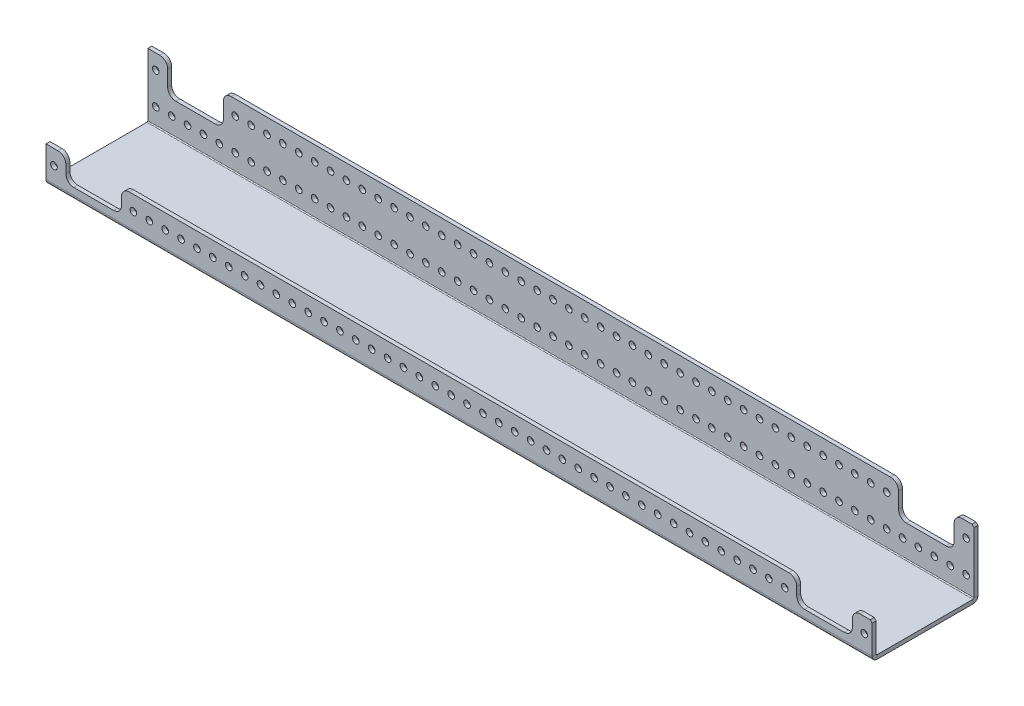
from build123d import *

# Parameters (mm, degrees)
SKETCH1_W             = 787.4
SKETCH1_H             = 78.232
BOSS_EXTRUDE1_DEPTH   = 3.175
EDGE_FLANGE1_DEPTH    = 787.4
EDGE_FLANGE1_2_DEPTH  = 787.4
EDGE_FLANGE2_DEPTH    = 787.4
EDGE_FLANGE2_2_DEPTH  = 787.4
SKETCH9_R             = 2.667
CUT_EXTRUDE1_DEPTH    = 794.767078776
CHAMFER1_SIZE         = 1.5875
LPATTERN1_COUNT       = 62
LPATTERN1_PITCH       = 12.7
SKETCH10_W            = 127
SKETCH10_H            = 125.202186064
CUT_EXTRUDE2_DEPTH    = 794.767078776
SKETCH14_R            = 2.667
CUT_EXTRUDE6_DEPTH    = 5.08
LPATTERN4_COUNT       = 62
LPATTERN4_PITCH       = 12.7
CUT_EXTRUDE7_REACH    = 795.767
SKETCH15_W            = 44.45
SKETCH15_H            = 25.4
LPATTERN5_COUNT       = 2
LPATTERN5_PITCH       = 584.2
LPATTERN6_START       = 142.875
LPATTERN6_OUTLINE_W   = 19.05
LPATTERN6_OUTLINE_H   = 3.175
LPATTERN6_DEPTH       = 44.45
LPATTERN6_START_2     = 727.075
LPATTERN6_2_OUTLINE_W = 19.05
LPATTERN6_2_OUTLINE_H = 3.175
LPATTERN6_2_DEPTH     = 44.45
FILLET1_R             = 6.35


# Read off the part's stored shape, not the designer's step: Edge-Flange1, Edge-Flange2, LPattern6
with BuildPart() as part:
    # Sketch1 → Boss-Extrude1 (new body)
    with BuildSketch(Plane(origin=(0, 0, 0), x_dir=(1, 0, 0), z_dir=(0, 1, 0))):
        with Locations((393.7, 39.116)):
            Rectangle(SKETCH1_W, SKETCH1_H)
    extrude(amount=BOSS_EXTRUDE1_DEPTH)

    # Edge-Flange1 outline → Edge-Flange1 (cut)
    with BuildSketch(Plane.YZ):
        with BuildLine():
            Line((0, -78.232), (0.074445793, -78.232))
            ThreePointArc((0.074445793, -78.232), (0.018655648, -77.852813981), (0, -77.47))
            Line((0, -77.47), (0, -78.232))
        make_face()
    extrude(amount=EDGE_FLANGE1_DEPTH, mode=Mode.SUBTRACT)

    # Edge-Flange1 2 outline → Edge-Flange1 2 (add)
    with BuildSketch(Plane.YZ):
        with BuildLine():
            ThreePointArc((0.074445793, -78.232), (1.4370025, -80.511378224), (3.937, -81.407))
            Line((3.937, -81.407), (53.975, -81.407))
            Line((53.975, -81.407), (53.975, -78.232))
            Line((53.975, -78.232), (3.937, -78.232))
            ThreePointArc((3.937, -78.232), (3.398184633, -78.008815367), (3.175, -77.47))
            Line((3.175, -77.47), (3.175, -78.232))
            Line((3.175, -78.232), (0.074445793, -78.232))
        make_face()
    extrude(amount=EDGE_FLANGE1_2_DEPTH)

    # Edge-Flange2 outline → Edge-Flange2 (cut)
    with BuildSketch(Plane.YZ):
        with BuildLine():
            ThreePointArc((0, -0.762), (0.018655648, -0.379186019), (0.074445793, 0))
            Line((0.074445793, 0), (0, 0))
            Line((0, 0), (0, -0.762))
        make_face()
    extrude(amount=EDGE_FLANGE2_DEPTH, mode=Mode.SUBTRACT)

    # Edge-Flange2 2 outline → Edge-Flange2 2 (add)
    with BuildSketch(Plane.YZ):
        with BuildLine():
            Line((28.575, 3.175), (3.937, 3.175))
            ThreePointArc((3.937, 3.175), (1.4370025, 2.279378224), (0.074445793, 0))
            Line((0.074445793, 0), (3.175, 0))
            Line((3.175, 0), (3.175, -0.762))
            ThreePointArc((3.175, -0.762), (3.398184633, -0.223184633), (3.937, 0))
            Line((3.937, 0), (28.575, 0))
            Line((28.575, 0), (28.575, 3.175))
        make_face()
    extrude(amount=EDGE_FLANGE2_2_DEPTH)

    # Sketch9 → Cut-Extrude1 (cut, through all)
    with BuildSketch(Plane.XY.offset(3.175)):
        with Locations((781.05, 16.637)):
            Circle(SKETCH9_R)
    cut_extrude1 = extrude(amount=-CUT_EXTRUDE1_DEPTH, mode=Mode.SUBTRACT)

    # Chamfer1
    chamfer1_edges = [part.edges().sort_by_distance(p)[0] for p in [
        (787.4, 53.975, -79.8195),
        (0, 53.975, -79.8195),
        (0, 28.575, 1.5875),
        (787.4, 28.575, 1.5875),
    ]]
    chamfer(chamfer1_edges, length=CHAMFER1_SIZE)

    # LPattern1: Cut-Extrude1 ×62
    with Locations(*[(-i * LPATTERN1_PITCH, 0, 0) for i in range(1, LPATTERN1_COUNT)]):
        add(cut_extrude1, mode=Mode.SUBTRACT)

    # Sketch10 → Cut-Extrude2 (cut, through all)
    with BuildSketch(Plane.XY.offset(3.175)):
        with Locations((63.5, 62.601093032)):
            Rectangle(SKETCH10_W, SKETCH10_H)
    extrude(amount=-CUT_EXTRUDE2_DEPTH, mode=Mode.SUBTRACT)

    # Sketch14 → Cut-Extrude6 (cut)
    with BuildSketch(Plane(origin=(0, 0, -81.407), x_dir=(-1, 0, 0), z_dir=(0, 0, -1))):
        with Locations(Location((-781.05, 42.037, 0), (0, 0, 90))):
            Circle(SKETCH14_R)
    cut_extrude6 = extrude(amount=-CUT_EXTRUDE6_DEPTH, mode=Mode.SUBTRACT)

    # LPattern4: Cut-Extrude6 ×62
    with Locations(*[(-i * LPATTERN4_PITCH, 0, 0) for i in range(1, LPATTERN4_COUNT)]):
        add(cut_extrude6, mode=Mode.SUBTRACT)

    # Sketch15 → Cut-Extrude7 (cut, up to next)
    with BuildSketch(Plane(origin=(0, 0, -81.407), x_dir=(-1, 0, 0), z_dir=(0, 0, -1)), mode=Mode.PRIVATE) as cut_extrude7_sk1:
        with Locations((-749.3, 41.275)):
            Rectangle(SKETCH15_W, SKETCH15_H)
    cut_extrude7_tool1 = extrude(cut_extrude7_sk1.sketch, amount=-CUT_EXTRUDE7_REACH, mode=Mode.PRIVATE) & part.part
    cut_extrude7 = cut_extrude7_tool1.solids().sort_by_distance((749.3, 41.275, -81.407))[0]
    add(cut_extrude7, mode=Mode.SUBTRACT)

    # LPattern5: Cut-Extrude7 ×2
    with Locations(*[(-i * LPATTERN5_PITCH, 0, 0) for i in range(1, LPATTERN5_COUNT)]):
        add(cut_extrude7, mode=Mode.SUBTRACT)

    # LPattern6 outline → LPattern6 (cut)
    with BuildSketch(Plane.YZ.offset(LPATTERN6_START)):
        with Locations((19.05, 1.5875)):
            Rectangle(LPATTERN6_OUTLINE_W, LPATTERN6_OUTLINE_H)
    extrude(amount=LPATTERN6_DEPTH, mode=Mode.SUBTRACT)

    # LPattern6 2 outline → LPattern6 2 (cut)
    with BuildSketch(Plane.YZ.offset(LPATTERN6_START_2)):
        with Locations((19.05, 1.5875)):
            Rectangle(LPATTERN6_2_OUTLINE_W, LPATTERN6_2_OUTLINE_H)
    extrude(amount=LPATTERN6_2_DEPTH, mode=Mode.SUBTRACT)

    # Fillet1
    fillet1_edges = [part.edges().sort_by_distance(p)[0] for p in [
        (727.075, 28.575, -79.8195),
        (771.525, 53.975, -79.8195),
        (727.075, 53.975, -79.8195),
        (771.525, 28.575, -79.8195),
        (142.875, 28.575, -79.8195),
        (187.325, 53.975, -79.8195),
        (142.875, 53.975, -79.8195),
        (187.325, 28.575, -79.8195),
        (142.875, 28.575, 1.5875),
        (142.875, 9.525, 1.5875),
        (187.325, 9.525, 1.5875),
        (187.325, 28.575, 1.5875),
        (727.075, 28.575, 1.5875),
        (727.075, 9.525, 1.5875),
        (771.525, 9.525, 1.5875),
        (771.525, 28.575, 1.5875),
    ]]
    fillet(fillet1_edges, radius=FILLET1_R)


solid = part.part
